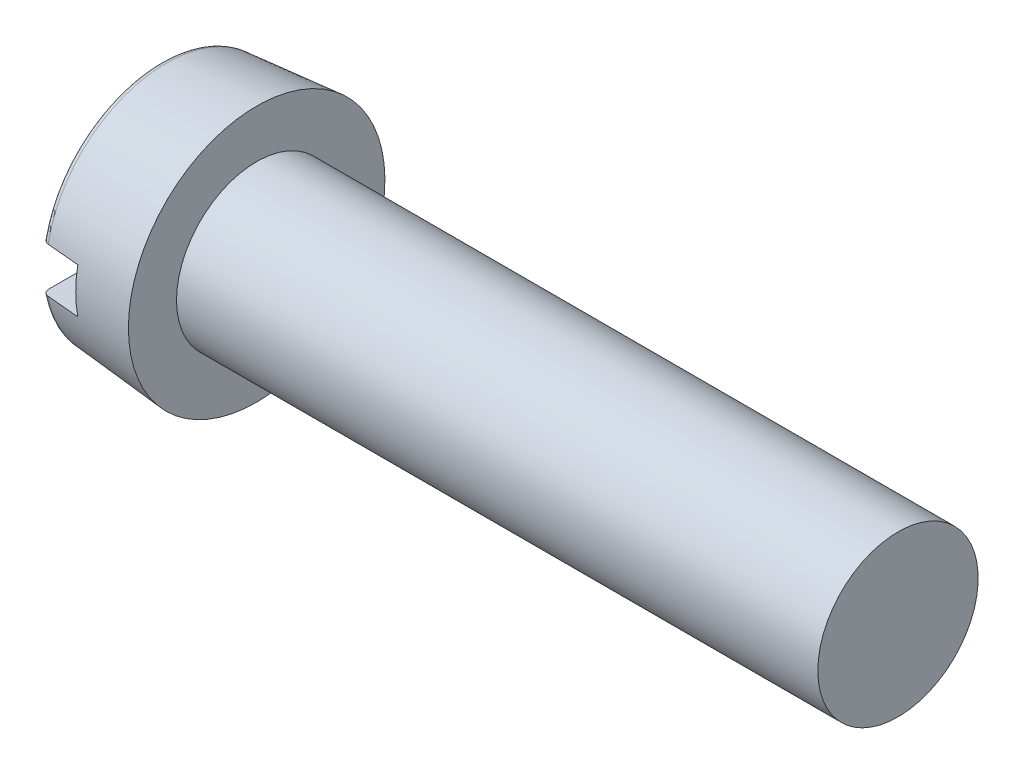
from build123d import *

# Parameters (mm, degrees)
FILLET1_R  = 0.4
SLOTSKE_W  = 16
SLOTSKE_H  = 2.81
SLOT_DEPTH = 2.4


with BuildPart() as part:
    # BodySke → BaseBody (revolve)
    with BuildSketch(Plane.XY):
        Polygon((0, 0), (0, 7.475068019), (6, 8), (6, 5), (46, 5), (46, 0), align=None)
    revolve(axis=Axis((0, 0, 0), (1, 0, 0)))

    # Fillet1
    fillet1_edges = [part.edges().sort_by_distance(p)[0] for p in [
        (0, -7.475068019, 0),
    ]]
    fillet(fillet1_edges, radius=FILLET1_R)

    # SlotSke → Slot (cut)
    with BuildSketch(Plane.ZY):
        Rectangle(SLOTSKE_W, SLOTSKE_H)
    extrude(amount=-SLOT_DEPTH, mode=Mode.SUBTRACT)


solid = part.part
